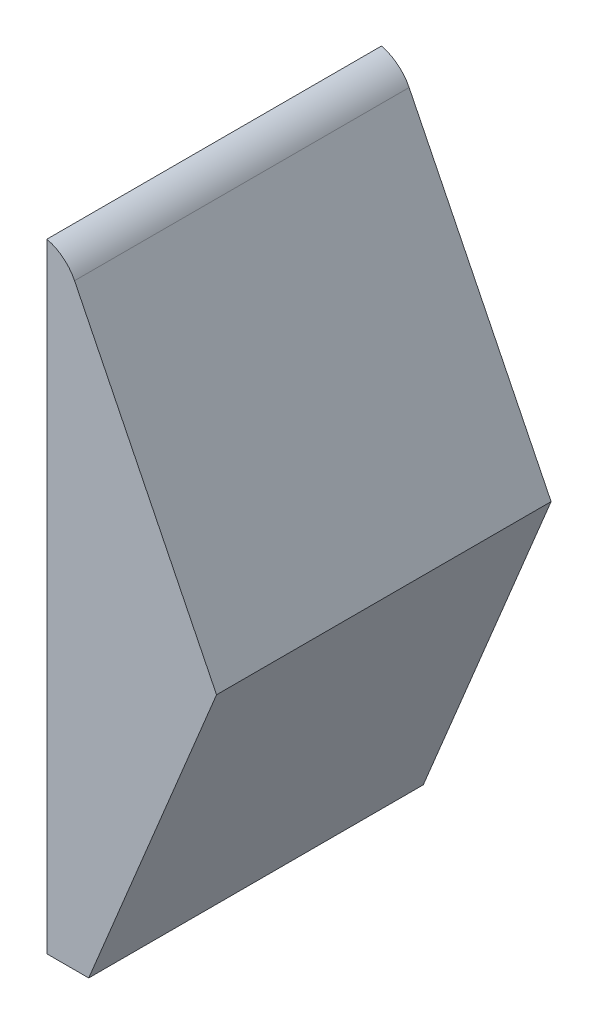
from build123d import *

# Parameters (mm, degrees)
BOSS_EXTRUDE1_DEPTH = 20
FILLET3_R           = 5


with BuildPart() as part:
    # Sketch1 → Boss-Extrude1 (new, symmetric)
    with BuildSketch(Plane.XY):
        Polygon((0, 0), (0, 74), (2, 74), (20.281232104, 36.965983625), (5, 0), align=None)
    extrude(amount=BOSS_EXTRUDE1_DEPTH, both=True)

    # Fillet3
    # the kernel refuses this fillet: 5 mm, written as the material it takes off along each edge
    with BuildSketch(Plane(origin=(2, 74, 27.377711493), x_dir=(0.4426407168839213, -0.8966990552891692, 0), z_dir=(0, 0, -1))) as fillet3_piece_1:
        with BuildLine():
            CenterArc((2.951084597, 5), FILLET3_R, 219.89034736, 50.10965264)
            Line((-0.885281434, 1.793398111), (-0.962008754, 1.729266073))
            ThreePointArc((-0.962008754, 1.729266073), (-0.532310622, 0.852434984), (-0.089669906, -0.044264072))
            Line((-0.089669906, -0.044264072), (0, -0.1))
            Line((0, -0.1), (2.951084597, -0.1))
            Line((2.951084597, -0.1), (2.951084597, 0))
        make_face()
    extrude(amount=54.755422985, mode=Mode.SUBTRACT)


solid = part.part
